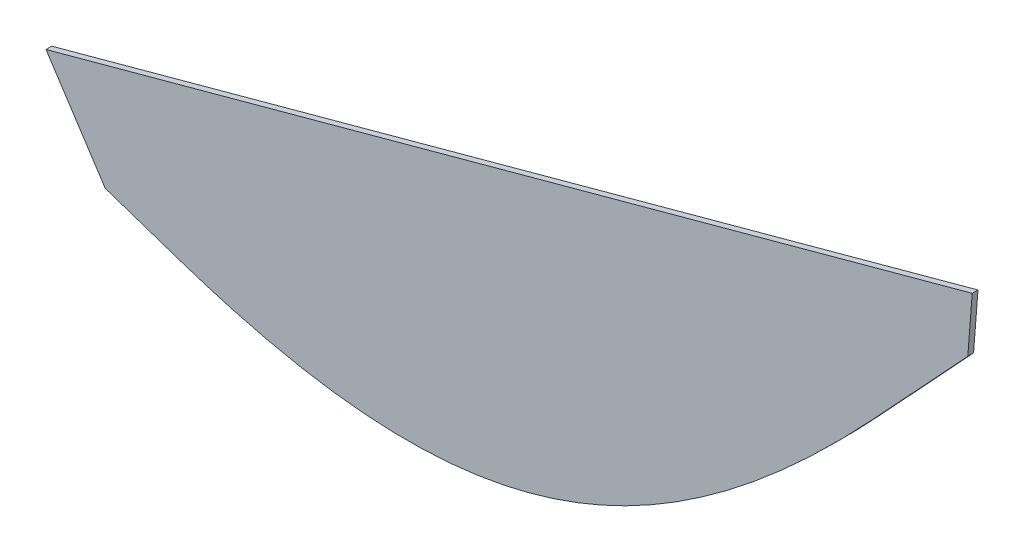
from build123d import *

# Parameters (mm, degrees)
EXTRUDE_1_DEPTH          = 5
CUT_EXTRUDE_1_DEPTH      = 1094.936170742
CUT_EXTRUDE_1_DEPTH_BACK = 1094.936170742
EXTRUDE_START            = -10
EXTRUDE_2_DEPTH          = 10


# Read off the part's stored shape, not the designer's step: Бобышка-Вытянуть2
with BuildPart() as part:
    # Эскиз8 → Бобышка-Вытянуть1 (new, symmetric)
    with BuildSketch(Plane.XY):
        with BuildLine():
            Line((700.44072507, 518.714066318), (700.44072507, 840.270275573))
            Line((700.44072507, 840.270275573), (-504.056787588, 840.270275573))
            Line((-504.056787588, 840.270275573), (-504.056787588, 154.00379042))
            add(Edge.make_bspline(
                [(-504.056787588, 154.00379042), (-26.495808626, -6.657301205), (300.332199959, 88.439706024), (700.44072507, 518.714066318)],
                knots=[0, 0, 0, 0, 1, 1, 1, 1], degree=3))
        make_face()
    extrude(amount=EXTRUDE_1_DEPTH, both=True)

    # Эскиз9 → Вырез-Вытянуть1 (cut, two sides: drawn at the far end of the back side and taken through both)
    with BuildSketch(Plane.XY.offset(-CUT_EXTRUDE_1_DEPTH_BACK)):
        Polygon((-593.261399646, 393.06592095), (813.606139874, 775.797425669), (448.342415586, 1086.649231028), (-713.243753546, 944.095990713), align=None)
    extrude(amount=CUT_EXTRUDE_1_DEPTH + CUT_EXTRUDE_1_DEPTH_BACK, mode=Mode.SUBTRACT)

    # Бобышка-Вытянуть2 outline → Бобышка-Вытянуть2 (add)
    with BuildSketch(Plane(origin=(0, 0, -5), x_dir=(-1, 0, 0), z_dir=(0, 0, -1)).offset(EXTRUDE_START)):
        with BuildLine():
            Line((735.441473343, 354.386520069), (504.056787588, 417.333603899))
            Line((504.056787588, 417.333603899), (504.056787588, 154.00379042))
            add(Edge.make_bspline(
                [(632.852748705, 197.333334963), (589.920761666, 182.890153448), (546.988774627, 168.446971934), (504.056787588, 154.00379042)],
                knots=[-0.08989844, -0.08989844, -0.08989844, -0.08989844, 0, 0, 0, 0], degree=3))
            Line((632.852748705, 197.333334963), (735.441473343, 354.386520069))
        make_face()
        with BuildLine():
            add(Edge.make_bspline(
                [(-700.44072507, 518.714066318), (-754.339405201, 576.676390684), (-808.238085332, 634.63871505), (-862.136765463, 692.601039415)],
                knots=[1, 1, 1, 1, 1.134710152, 1.134710152, 1.134710152, 1.134710152], degree=3))
            Line((-700.44072507, 518.714066318), (-700.44072507, 745.011322306))
            Line((-700.44072507, 745.011322306), (-869.827615138, 791.092205896))
            Line((-869.827615138, 791.092205896), (-862.136765463, 692.601039415))
        make_face()
    extrude(amount=EXTRUDE_2_DEPTH)


solid = part.part
